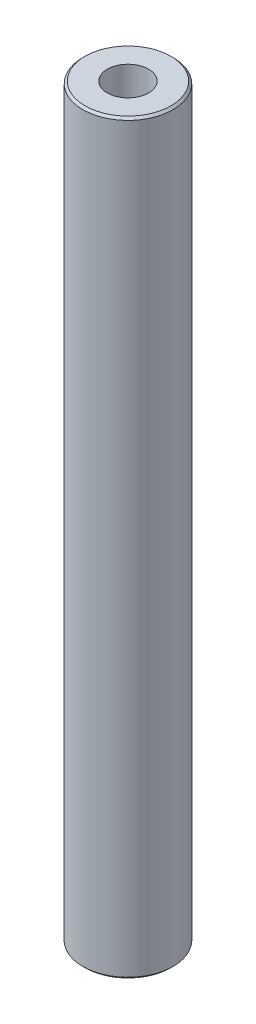
from build123d import *

# Parameters (mm, degrees)
SKETCH1_R           = 15
BOSS_EXTRUDE1_DEPTH = 248.133667649
SKETCH2_R           = 6.863999946
CUT_EXTRUDE1_DEPTH  = 250.038786178
CHAMFER1_SIZE       = 0.724541428


with BuildPart() as part:
    # Sketch1 → Boss-Extrude1 (new body)
    with BuildSketch(Plane(origin=(0, 0, 0), x_dir=(1, 0, 0), z_dir=(0, 1, 0))):
        Circle(SKETCH1_R)
    extrude(amount=BOSS_EXTRUDE1_DEPTH)

    # Sketch2 → Cut-Extrude1 (cut, through all)
    with BuildSketch(Plane(origin=(0, 0, 0), x_dir=(1, 0, 0), z_dir=(0, 1, 0))):
        Circle(SKETCH2_R)
    extrude(amount=CUT_EXTRUDE1_DEPTH, mode=Mode.SUBTRACT)

    # Chamfer1
    chamfer1_edges = [part.edges().sort_by_distance(p)[0] for p in [
        (-15, 248.133667649, 0),
        (-15, 0, 0),
    ]]
    chamfer(chamfer1_edges, length=CHAMFER1_SIZE)


solid = part.part
